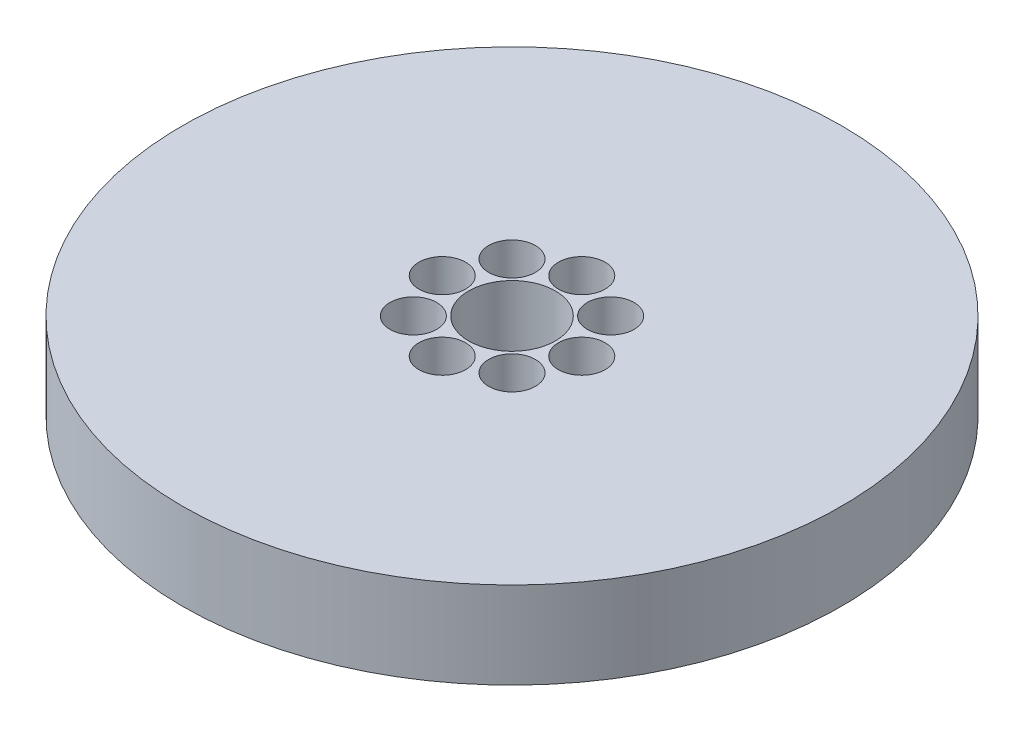
from build123d import *

# Parameters (mm, degrees)
SKETCH1_R           = 95
BOSS_EXTRUDE1_DEPTH = 25
SKETCH2_R           = 12.5
CUT_EXTRUDE1_DEPTH  = 137.656503687
SKETCH3_R           = 6.73722953
CUT_EXTRUDE2_DEPTH  = 19.271102921
CIRPATTERN1_COUNT   = 8


with BuildPart() as part:
    # Sketch1 → Boss-Extrude1 (new body)
    with BuildSketch(Plane(origin=(0, 0, 0), x_dir=(1, 0, 0), z_dir=(0, 1, 0))):
        Circle(SKETCH1_R)
    extrude(amount=BOSS_EXTRUDE1_DEPTH)

    # Sketch2 → Cut-Extrude1 (cut, through all)
    with BuildSketch(Plane(origin=(0, 0, 0), x_dir=(1, 0, 0), z_dir=(0, 1, 0))):
        Circle(SKETCH2_R)
    extrude(amount=CUT_EXTRUDE1_DEPTH, mode=Mode.SUBTRACT)

    # Sketch3 → Cut-Extrude2 (cut)
    with BuildSketch(Plane(origin=(0, 25, 0), x_dir=(1, 0, 0), z_dir=(0, 1, 0))):
        with Locations((-20.111318445, 0)):
            Circle(SKETCH3_R)
    cut_extrude2 = extrude(amount=-CUT_EXTRUDE2_DEPTH, mode=Mode.SUBTRACT)

    # CirPattern1: Cut-Extrude2 ×8 about axis
    cirpattern1_axis = Axis((0, 0, 0), (0, 1, 0))
    for i in range(1, CIRPATTERN1_COUNT):
        add(cut_extrude2.rotate(cirpattern1_axis, i * 360 / CIRPATTERN1_COUNT), mode=Mode.SUBTRACT)


solid = part.part
